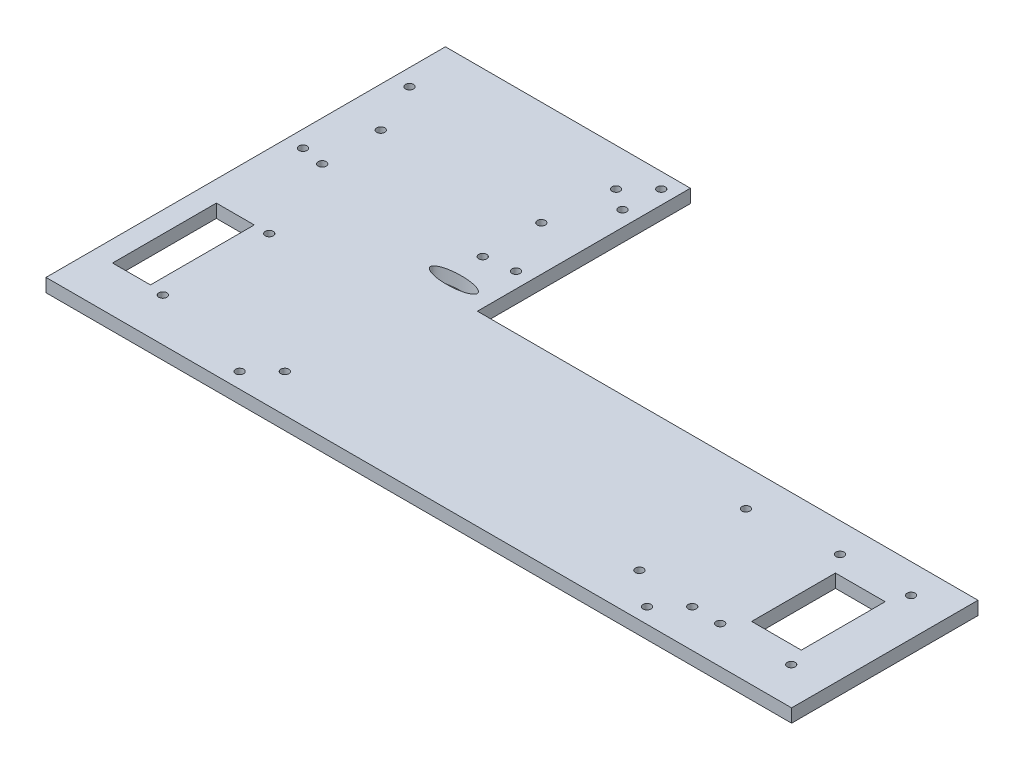
from build123d import *

# Parameters (mm, degrees)
SKETCH1_R           = 1.5
SKETCH1_W           = 14.230558195
SKETCH1_H           = 38.999746335
SKETCH1_W_2         = 18.658985537
SKETCH1_H_2         = 31.487038094
BOSS_EXTRUDE1_DEPTH = 5


with BuildPart() as part:
    # Sketch1 → Boss-Extrude1 (new body)
    with BuildSketch(Plane(origin=(0, 0, 0), x_dir=(1, 0, 0), z_dir=(0, 1, 0))):
        Polygon((-124.555160142, 9.217081851), (-124.555160142, -60.782918149), (155.444839858, -60.782918149), (155.444839858, 9.217081851), (-32.555160142, 9.217081851), (-32.555160142, 89.217081851), (-124.555160142, 89.217081851), align=None)
        with Locations((-96.88048066, -44.579371447)):
            Circle(SKETCH1_R, mode=Mode.SUBTRACT)
        with Locations((-57.609979708, -55.025558837)):
            Circle(SKETCH1_R, mode=Mode.SUBTRACT)
        with Locations((-109.616514698, -24.123779742)):
            Rectangle(SKETCH1_W, SKETCH1_H, mode=Mode.SUBTRACT)
        with Locations((-49.124698334, -46.540277462)):
            Circle(SKETCH1_R, mode=Mode.SUBTRACT)
        with Locations((-96.88048066, -4.623906574)):
            Circle(SKETCH1_R, mode=Mode.SUBTRACT)
        with Locations((82.11951934, -44.623906574)):
            Circle(SKETCH1_R, mode=Mode.SUBTRACT)
        with Locations((95.397169695, -55.030629714)):
            Circle(SKETCH1_R, mode=Mode.SUBTRACT)
        with Locations((114.620218271, -46.782918149)):
            Circle(SKETCH1_R, mode=Mode.SUBTRACT)
        with Locations((103.88245107, -46.545348339)):
            Circle(SKETCH1_R, mode=Mode.SUBTRACT)
        with Locations((141.300092758, -46.782918149)):
            Circle(SKETCH1_R, mode=Mode.SUBTRACT)
        with Locations((129.159877134, -24.440324762)):
            Rectangle(SKETCH1_W_2, SKETCH1_H_2, mode=Mode.SUBTRACT)
        with Locations((82.11951934, -4.623906574)):
            Circle(SKETCH1_R, mode=Mode.SUBTRACT)
        with Locations((114.620218271, -1.782918149)):
            Circle(SKETCH1_R, mode=Mode.SUBTRACT)
        with Locations((141.300092758, -1.782918149)):
            Circle(SKETCH1_R, mode=Mode.SUBTRACT)
        with Locations((-109.616514697, 27.990725731)):
            Circle(SKETCH1_R, mode=Mode.SUBTRACT)
        with Locations((-118.326917326, 29.495275711)):
            Circle(SKETCH1_R, mode=Mode.SUBTRACT)
        with Locations((-109.616514697, 49.990725731)):
            Circle(SKETCH1_R, mode=Mode.SUBTRACT)
        with BuildLine():
            add(Edge.make_bspline(
                [(-38.326917326, 14.945625833), (-38.326917326, 19.789091306), (-51.516496629, 17.36735857), (-64.706075932, 14.945625833), (-51.516496629, 12.523893097), (-38.326917326, 10.102160361), (-38.326917326, 14.945625833)],
                knots=[0, 0, 0, 2.094395102, 2.094395102, 4.188790205, 4.188790205, 6.283185307, 6.283185307, 6.283185307], degree=2, weights=[1, 0.5, 1, 0.5, 1, 0.5, 1]))
        make_face(mode=Mode.SUBTRACT)
        with Locations((-49.316514697, 27.990725731)):
            Circle(SKETCH1_R, mode=Mode.SUBTRACT)
        with Locations((-38.326917326, 29.495275711)):
            Circle(SKETCH1_R, mode=Mode.SUBTRACT)
        with Locations((-49.316514697, 49.990725731)):
            Circle(SKETCH1_R, mode=Mode.SUBTRACT)
        with Locations((-118.326917326, 69.495275711)):
            Circle(SKETCH1_R, mode=Mode.SUBTRACT)
        with Locations((-38.326917326, 69.495275711)):
            Circle(SKETCH1_R, mode=Mode.SUBTRACT)
        with Locations((-46.23753647, 74.974441163)):
            Circle(SKETCH1_R, mode=Mode.SUBTRACT)
        with Locations((-37.752255096, 83.459722538)):
            Circle(SKETCH1_R, mode=Mode.SUBTRACT)
    extrude(amount=BOSS_EXTRUDE1_DEPTH)


solid = part.part
